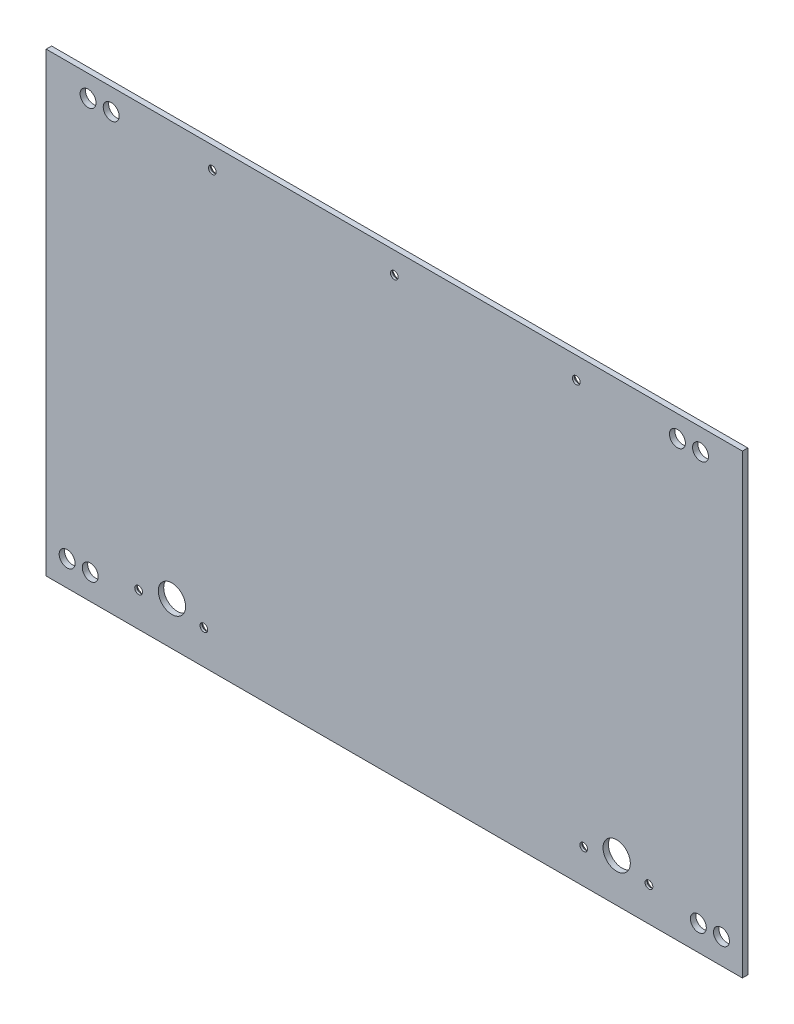
from build123d import *

# Parameters (mm, degrees)
SKETCH1_W                                      = 306.05
SKETCH1_H                                      = 197.425
BOSS_EXTRUDE1_DEPTH                            = 2.38125
SKETCH9_W                                      = 306.05
SKETCH9_H                                      = 2.38125
BOSS_EXTRUDE2_DEPTH                            = 3.175
SKETCH10_R                                     = 3.5
CUT_EXTRUDE1_DEPTH                             = 184.856965146
CSK_FOR_M3_FLAT_HEAD_MACHINE_SCREW1_AT_2_COUNT = 2
CSK_FOR_M3_FLAT_HEAD_MACHINE_SCREW1_AT_2_PITCH = 28.69
CSK_FOR_M3_FLAT_HEAD_MACHINE_SCREW1_AT_3_COUNT = 2
CSK_FOR_M3_FLAT_HEAD_MACHINE_SCREW1_AT_3_PITCH = 178.948509983
CSK_FOR_M3_FLAT_HEAD_MACHINE_SCREW1_AT_4_COUNT = 2
CSK_FOR_M3_FLAT_HEAD_MACHINE_SCREW1_AT_4_PITCH = 208.645558843
CSK_FOR_M3_FLAT_HEAD_MACHINE_SCREW1_AT_5_COUNT = 2
CSK_FOR_M3_FLAT_HEAD_MACHINE_SCREW1_AT_5_PITCH = 260.467597265
CSK_FOR_M3_FLAT_HEAD_MACHINE_SCREW1_AT_6_COUNT = 2
CSK_FOR_M3_FLAT_HEAD_MACHINE_SCREW1_AT_6_PITCH = 224.342
CSK_FOR_M3_FLAT_HEAD_MACHINE_SCREW1_AT_7_COUNT = 2
CSK_FOR_M3_FLAT_HEAD_MACHINE_SCREW1_AT_7_PITCH = 195.652
SKETCH13_R                                     = 6
CUT_EXTRUDE2_DEPTH                             = 184.856965146


with BuildPart() as part:
    # Sketch1 → Boss-Extrude1 (new body)
    with BuildSketch(Plane.XY):
        Rectangle(SKETCH1_W, SKETCH1_H)
    extrude(amount=BOSS_EXTRUDE1_DEPTH)

    # Sketch9 → Boss-Extrude2 (add)
    with BuildSketch(Plane(origin=(0, 98.7125, 0), x_dir=(1, 0, 0), z_dir=(0, 1, 0))):
        with Locations((0, -1.190625)):
            Rectangle(SKETCH9_W, SKETCH9_H)
    extrude(amount=BOSS_EXTRUDE2_DEPTH)

    # Sketch10 → Cut-Extrude1 (cut, through all)
    with BuildSketch(Plane(origin=(0, 0, 0), x_dir=(-1, 0, 0), z_dir=(0, 0, -1))):
        with Locations((-134.610000066, 92.3625001)):
            Circle(SKETCH10_R)
        with Locations((-124.450000066, 92.3625001)):
            Circle(SKETCH10_R)
        with Locations((-143.817500066, -87.5375001)):
            Circle(SKETCH10_R)
        with Locations((-133.657500066, -87.537500101)):
            Circle(SKETCH10_R)
    cut_extrude1 = extrude(amount=-CUT_EXTRUDE1_DEPTH, mode=Mode.SUBTRACT)

    # Mirror1: Cut-Extrude1 across plane
    add(cut_extrude1.mirror(Plane(origin=(0, 0, 0), x_dir=(0, 0, 1), z_dir=(1, 0, 0))), mode=Mode.SUBTRACT)

    # Sketch12 → CSK for M3 Flat Head Machine Screw1 (revolve, cut)
    with BuildSketch(Plane(origin=(111.94, -83.7124999, 0), x_dir=(0, 1, 0), z_dir=(1, 0, 0))):
        Polygon((0, 0), (0, 2.38125), (1.7, 2.38125), (1.7, 1.45), (3.15, 0), align=None)
    csk_for_m3_flat_head_machine_screw1 = revolve(axis=Axis((111.94, -83.7124999, -6.35), (0, 0, 1)), mode=Mode.SUBTRACT)

    # CSK for M3 Flat Head Machine Screw1 at 2: CSK for M3 Flat Head Machine Screw1 ×2
    with Locations(*[(-i * CSK_FOR_M3_FLAT_HEAD_MACHINE_SCREW1_AT_2_PITCH, 0, 0) for i in range(1, CSK_FOR_M3_FLAT_HEAD_MACHINE_SCREW1_AT_2_COUNT)]):
        add(csk_for_m3_flat_head_machine_screw1, mode=Mode.SUBTRACT)

    # CSK for M3 Flat Head Machine Screw1 at 3: CSK for M3 Flat Head Machine Screw1 ×2
    with Locations(*[Vector(-0.17848709666869522, 0.983942252534558, 0) * (i * CSK_FOR_M3_FLAT_HEAD_MACHINE_SCREW1_AT_3_PITCH) for i in range(1, CSK_FOR_M3_FLAT_HEAD_MACHINE_SCREW1_AT_3_COUNT)]):
        add(csk_for_m3_flat_head_machine_screw1, mode=Mode.SUBTRACT)

    # CSK for M3 Flat Head Machine Screw1 at 4: CSK for M3 Flat Head Machine Screw1 ×2
    with Locations(*[Vector(-0.5365079449598511, 0.8438952689729676, 0) * (i * CSK_FOR_M3_FLAT_HEAD_MACHINE_SCREW1_AT_4_PITCH) for i in range(1, CSK_FOR_M3_FLAT_HEAD_MACHINE_SCREW1_AT_4_COUNT)]):
        add(csk_for_m3_flat_head_machine_screw1, mode=Mode.SUBTRACT)

    # CSK for M3 Flat Head Machine Screw1 at 5: CSK for M3 Flat Head Machine Screw1 ×2
    with Locations(*[Vector(-0.7369054808176487, 0.6759957931384706, 0) * (i * CSK_FOR_M3_FLAT_HEAD_MACHINE_SCREW1_AT_5_PITCH) for i in range(1, CSK_FOR_M3_FLAT_HEAD_MACHINE_SCREW1_AT_5_COUNT)]):
        add(csk_for_m3_flat_head_machine_screw1, mode=Mode.SUBTRACT)

    # CSK for M3 Flat Head Machine Screw1 at 6: CSK for M3 Flat Head Machine Screw1 ×2
    with Locations(*[(-i * CSK_FOR_M3_FLAT_HEAD_MACHINE_SCREW1_AT_6_PITCH, 0, 0) for i in range(1, CSK_FOR_M3_FLAT_HEAD_MACHINE_SCREW1_AT_6_COUNT)]):
        add(csk_for_m3_flat_head_machine_screw1, mode=Mode.SUBTRACT)

    # CSK for M3 Flat Head Machine Screw1 at 7: CSK for M3 Flat Head Machine Screw1 ×2
    with Locations(*[(-i * CSK_FOR_M3_FLAT_HEAD_MACHINE_SCREW1_AT_7_PITCH, 0, 0) for i in range(1, CSK_FOR_M3_FLAT_HEAD_MACHINE_SCREW1_AT_7_COUNT)]):
        add(csk_for_m3_flat_head_machine_screw1, mode=Mode.SUBTRACT)

    # Sketch13 → Cut-Extrude2 (cut, through all)
    with BuildSketch(Plane(origin=(0, 0, 0), x_dir=(-1, 0, 0), z_dir=(0, 0, -1))):
        with Locations((-97.75, -79.7125)):
            Circle(SKETCH13_R)
        with Locations((97.75, -79.7125)):
            Circle(SKETCH13_R)
    extrude(amount=-CUT_EXTRUDE2_DEPTH, mode=Mode.SUBTRACT)


solid = part.part
